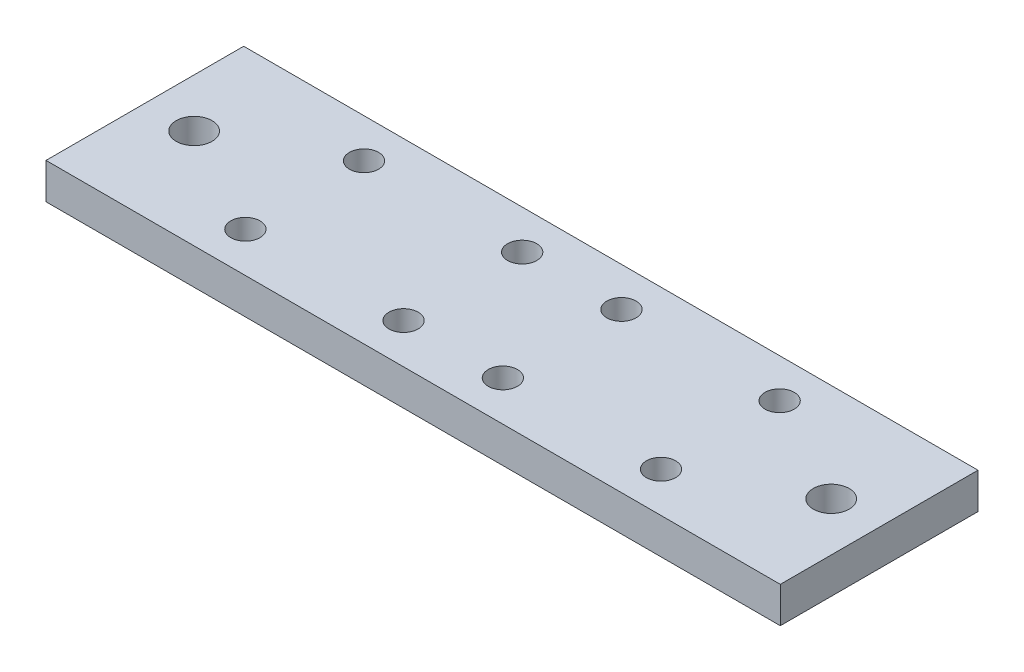
from build123d import *

# Parameters (mm, degrees)
SKETCH1_W           = 130
SKETCH1_H           = 35
BOSS_EXTRUDE1_DEPTH = 6.35
SKETCH5_R           = 3.18
CUT_EXTRUDE2_DEPTH  = 135.778790987
SKETCH8_R           = 2.58660254
CUT_EXTRUDE4_DEPTH  = 135.778790987


with BuildPart() as part:
    # Sketch1 → Boss-Extrude1 (new body)
    with BuildSketch(Plane(origin=(0, 0, 0), x_dir=(1, 0, 0), z_dir=(0, 1, 0))):
        with Locations((65, -17.5)):
            Rectangle(SKETCH1_W, SKETCH1_H)
    extrude(amount=BOSS_EXTRUDE1_DEPTH)

    # Sketch5 → Cut-Extrude2 (cut, through all)
    with BuildSketch(Plane(origin=(0, 6.35, 0), x_dir=(1, 0, 0), z_dir=(0, 1, 0))):
        with Locations((8.605, -17.382603272)):
            Circle(SKETCH5_R)
        with Locations((121.395, -17.382603272)):
            Circle(SKETCH5_R)
    extrude(amount=-CUT_EXTRUDE2_DEPTH, mode=Mode.SUBTRACT)

    # Sketch8 → Cut-Extrude4 (cut, through all)
    with BuildSketch(Plane.XZ):
        with Locations((101.793496513, 27.911326269)):
            Circle(SKETCH8_R)
        with Locations((101.793496513, 6.911326269)):
            Circle(SKETCH8_R)
        with Locations((73.793496513, 6.911326269)):
            Circle(SKETCH8_R)
        with Locations((73.793496513, 27.911326269)):
            Circle(SKETCH8_R)
        with Locations((56.211544386, 27.911326269)):
            Circle(SKETCH8_R)
        with Locations((56.211544386, 6.911326269)):
            Circle(SKETCH8_R)
        with Locations((28.211544386, 6.911326269)):
            Circle(SKETCH8_R)
        with Locations((28.211544386, 27.911326269)):
            Circle(SKETCH8_R)
    extrude(amount=-CUT_EXTRUDE4_DEPTH, mode=Mode.SUBTRACT)


solid = part.part
